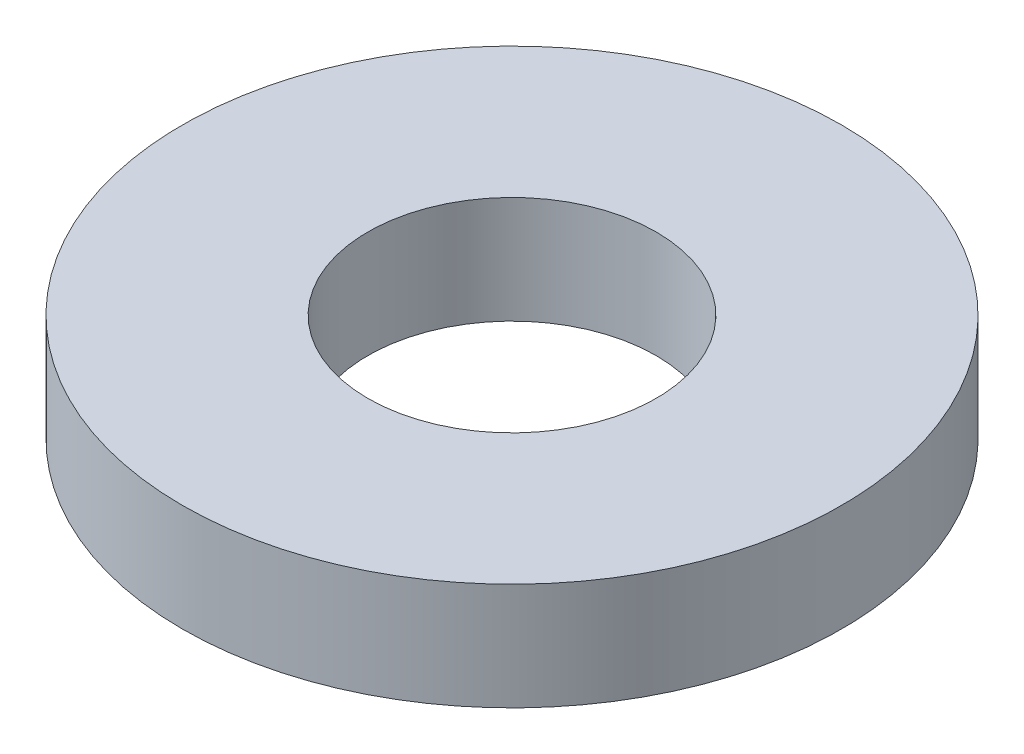
from build123d import *

# Parameters (mm, degrees)
SKETCH1_R           = 40
BOSS_EXTRUDE1_DEPTH = 13
SKETCH2_R           = 17.5
CUT_EXTRUDE1_DEPTH  = 59.043087444


with BuildPart() as part:
    # Sketch1 → Boss-Extrude1 (new body)
    with BuildSketch(Plane(origin=(0, 0, 0), x_dir=(1, 0, 0), z_dir=(0, 1, 0))):
        Circle(SKETCH1_R)
    extrude(amount=BOSS_EXTRUDE1_DEPTH)

    # Sketch2 → Cut-Extrude1 (cut, through all)
    with BuildSketch(Plane(origin=(0, 0, 0), x_dir=(1, 0, 0), z_dir=(0, 1, 0))):
        Circle(SKETCH2_R)
    extrude(amount=CUT_EXTRUDE1_DEPTH, mode=Mode.SUBTRACT)


solid = part.part
